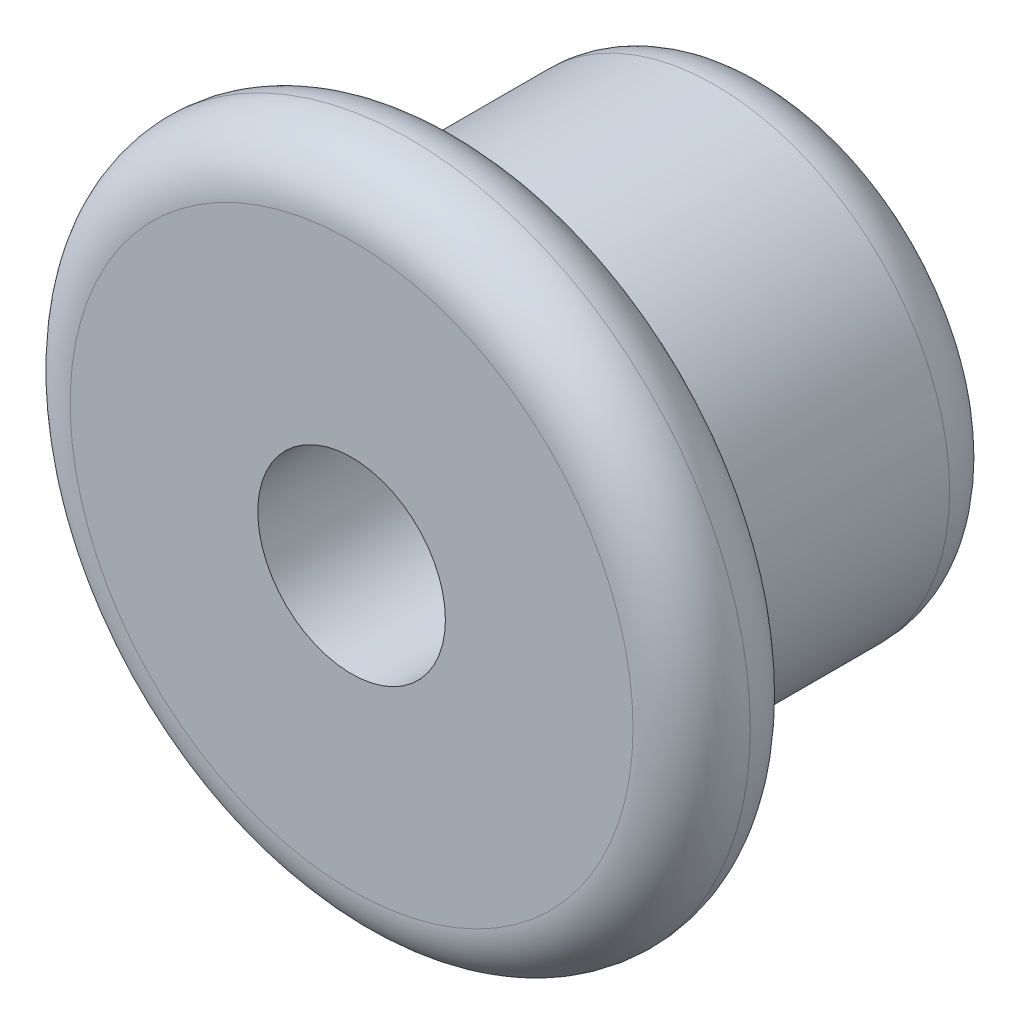
from build123d import *

# Parameters (mm, degrees)
SKETCH_1_R               = 2
EXTRUDE_1_DEPTH          = 2.6
SKETCH_2_R               = 2.9
EXTRUDE_2_DEPTH          = 1
CUT_EXTRUDE_1_DEPTH      = 6.45710546
CUT_EXTRUDE_1_DEPTH_BACK = 6.45710546
SKETCH_3_R               = 0.8
FILLET_2_R               = 0.5


with BuildPart() as part:
    # 草图1 → 凸台-拉伸1 (new body)
    with BuildSketch(Plane.XY):
        Circle(SKETCH_1_R)
    extrude(amount=EXTRUDE_1_DEPTH)

    # 草图2 → 凸台-拉伸2 (add)
    with BuildSketch(Plane.XY.offset(2.6)):
        Circle(SKETCH_2_R)
    extrude(amount=EXTRUDE_2_DEPTH)

    # 草图3 → 切除-拉伸1 (cut, two sides: drawn at the far end of the back side and taken through both)
    with BuildSketch(Plane.XY.offset(3.6).offset(-CUT_EXTRUDE_1_DEPTH_BACK)):
        Circle(SKETCH_3_R)
    extrude(amount=CUT_EXTRUDE_1_DEPTH + CUT_EXTRUDE_1_DEPTH_BACK, mode=Mode.SUBTRACT)

    # 圆角2
    fillet_2_edges = [part.edges().sort_by_distance(p)[0] for p in [
        (-2, 0, 0),
        (-2.9, 0, 2.6),
        (-2.9, 0, 3.6),
    ]]
    fillet(fillet_2_edges, radius=FILLET_2_R - 0.0001)  # a hair under: the kernel refuses the full size


solid = part.part
